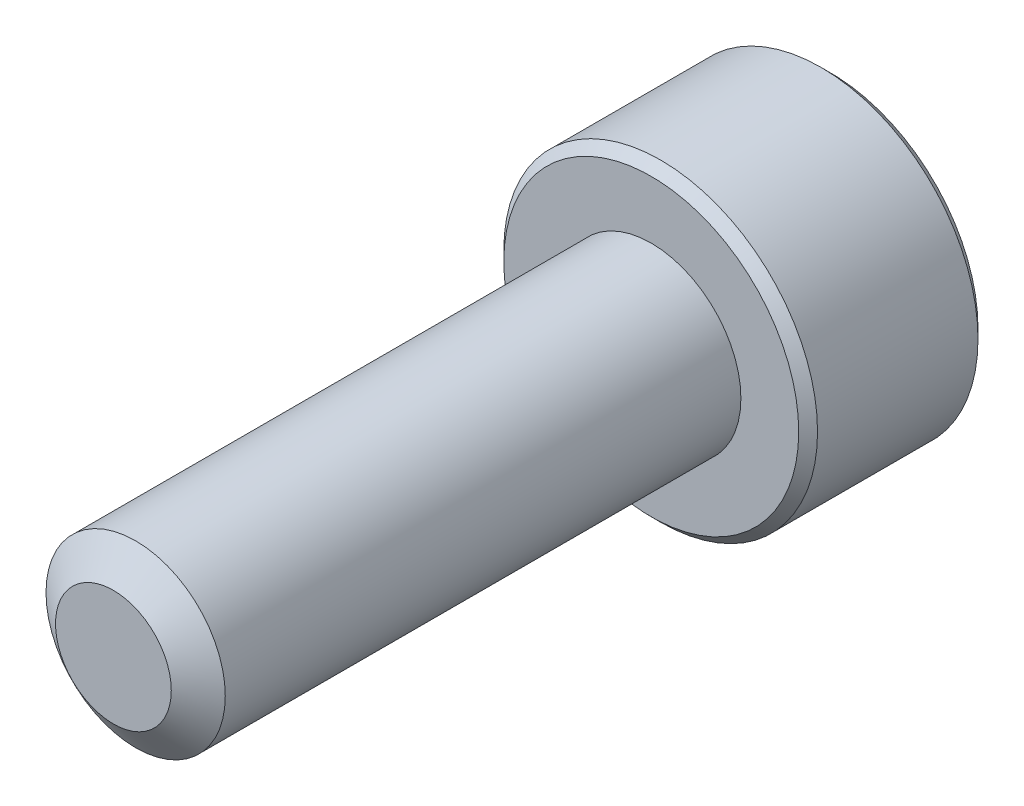
from build123d import *

# Parameters (mm, degrees)
SKETCH1_R          = 2
EXTRUDE1_DEPTH     = 12
SKETCH6_R          = 3.5
EXTRUDE2_DEPTH     = 4
CUT_EXTRUDE1_DEPTH = 2.25
CHAMFER1_SIZE      = 0.21


with BuildPart() as part:
    # Sketch1 → Extrude1 (new body)
    with BuildSketch(Plane.XY):
        Circle(SKETCH1_R)
    extrude(amount=-EXTRUDE1_DEPTH)

    # Sketch4 → Cut-Revolve1 (revolve, cut)
    with BuildSketch(Plane(origin=(0, 0, 0), x_dir=(0, 0, -1), z_dir=(1, 0, 0))):
        Polygon((0.496211411, 2), (0, 1.291336663), (0, 2), align=None)
    revolve(axis=Axis((0, 0, 0), (0, 0, -1)), mode=Mode.SUBTRACT)

    # Sketch6 → Extrude2 (add)
    with BuildSketch(Plane(origin=(0, 0, -12), x_dir=(-1, 0, 0), z_dir=(0, 0, -1))):
        Circle(SKETCH6_R)
    extrude(amount=EXTRUDE2_DEPTH)

    # Sketch7 → Cut-Extrude1 (cut)
    with BuildSketch(Plane(origin=(0, 0, -16), x_dir=(-1, 0, 0), z_dir=(0, 0, -1))):
        Polygon((0, 1.732050808), (-1.5, 0.866025404), (-1.5, -0.866025404), (0, -1.732050808), (1.5, -0.866025404), (1.5, 0.866025404), align=None)
    extrude(amount=-CUT_EXTRUDE1_DEPTH, mode=Mode.SUBTRACT)

    # Cut-Extrude2 cone 1 section (through the dimple's axis) → Cut-Extrude2 (revolve, cut)
    with BuildSketch(Plane(origin=(0, 0, -16), x_dir=(0, 1, 0), z_dir=(1, 0, 0))):
        Polygon((0, 0), (1.732050808, 0), (0, 1.732050808), align=None)
    revolve(axis=Axis((0, 0, -16), (0, 0, 1)), mode=Mode.SUBTRACT)

    # Chamfer1
    chamfer1_edges = [part.edges().sort_by_distance(p)[0] for p in [
        (3.5, 0, -16),
        (3.5, 0, -12),
    ]]
    chamfer(chamfer1_edges, length=CHAMFER1_SIZE)

    # Sketch10 → Revolve1 (revolve)
    with BuildSketch(Plane(origin=(0, 0, 0), x_dir=(0, 0, -1), z_dir=(1, 0, 0))):
        Polygon((12, 2), (12, 0), (10.996572875, 0), (11.825, 2), align=None)
    revolve(axis=Axis((0, 0, -12), (0, 0, 1)))


solid = part.part
